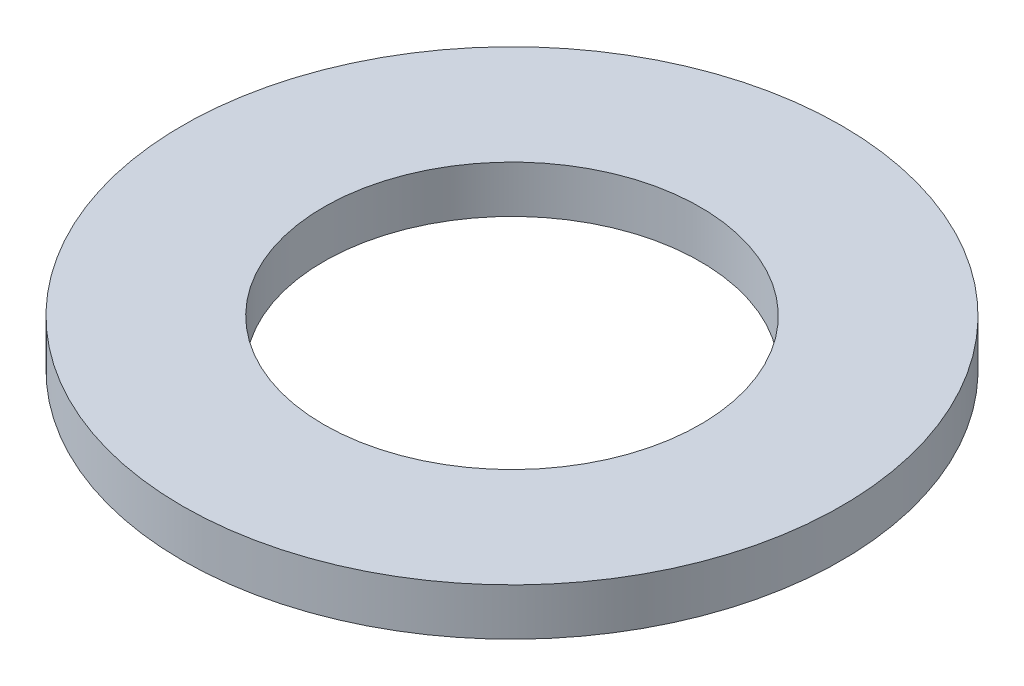
from build123d import *

# Parameters (mm, degrees)
SKETCH1_R           = 70
BOSS_EXTRUDE1_DEPTH = 10
SKETCH2_R           = 40
CUT_EXTRUDE1_DEPTH  = 100.498743711


with BuildPart() as part:
    # Sketch1 → Boss-Extrude1 (new body)
    with BuildSketch(Plane(origin=(0, 0, 0), x_dir=(1, 0, 0), z_dir=(0, 1, 0))):
        Circle(SKETCH1_R)
    extrude(amount=BOSS_EXTRUDE1_DEPTH)

    # Sketch2 → Cut-Extrude1 (cut, through all)
    with BuildSketch(Plane(origin=(0, 0, 0), x_dir=(1, 0, 0), z_dir=(0, 1, 0))):
        Circle(SKETCH2_R)
    extrude(amount=CUT_EXTRUDE1_DEPTH, mode=Mode.SUBTRACT)


solid = part.part
